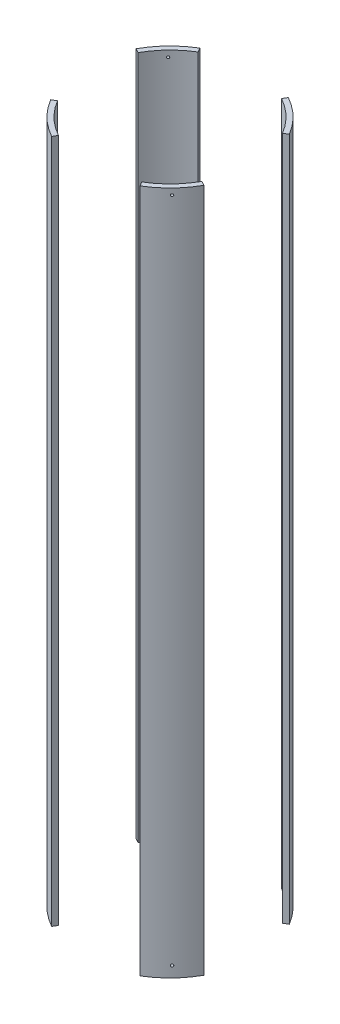
from build123d import *

# Parameters (mm, degrees)
SKETCH2_R               = 88.9
SKETCH2_R_2             = 83.82
BOSS_EXTRUDE1_DEPTH     = 349.510223
CUT_EXTRUDE1_DEPTH      = 372.434807176
CUT_EXTRUDE1_DEPTH_BACK = 372.434807176
SKETCH5_R               = 1.27
BOLT_HOLES_DEPTH        = 399.221412428
BOLT_PATTERN_COUNT      = 4


with BuildPart() as part:
    # Sketch2 → Boss-Extrude1 (new, symmetric)
    with BuildSketch(Plane(origin=(0, 0, 0), x_dir=(1, 0, 0), z_dir=(0, 1, 0))):
        Circle(SKETCH2_R)
        Circle(SKETCH2_R_2, mode=Mode.SUBTRACT)
    extrude(amount=BOSS_EXTRUDE1_DEPTH, both=True)

    # Sketch3 → Cut-Extrude1 (cut, two sides: drawn at the far end of the back side and taken through both)
    with BuildSketch(Plane(origin=(0, 0, 0), x_dir=(1, 0, 0), z_dir=(0, 1, 0)).offset(-CUT_EXTRUDE1_DEPTH_BACK)):
        Polygon((-58.116685864, 96.974944394), (0, 0), (53.900027233, 96.974944394), align=None)
        Polygon((70.991745134, -118.45858783), (0, 0), (-65.840936026, -118.45858783), align=None)
        Polygon((169.661755759, 101.677593364), (0, 0), (169.661755759, -94.300371224), align=None)
        Polygon((-123.741299607, -74.157652604), (0, 0), (-123.741299607, 68.777140945), align=None)
    extrude(amount=CUT_EXTRUDE1_DEPTH + CUT_EXTRUDE1_DEPTH_BACK, mode=Mode.SUBTRACT)


with BuildPart() as cut_extrude1_piece_1:
    # of the separate pieces the step leaves, piece 1, a body of its own (cut_extrude1_pieces)
    add(part.part.solids().sort_by_distance((-45.699187432, -349.510223, -76.254798328))[0])


with BuildPart() as cut_extrude1_piece_2:
    # of the separate pieces the step leaves, piece 2, a body of its own (cut_extrude1_pieces)
    add(part.part.solids().sort_by_distance((45.699187432, -349.510223, 76.254798328))[0])


with BuildPart() as cut_extrude1_piece_3:
    # of the separate pieces the step leaves, piece 3, a body of its own (cut_extrude1_pieces)
    add(part.part.solids().sort_by_distance((76.254798328, -349.510223, -45.699187432))[0])


with BuildPart() as cut_extrude1_piece_4:
    # of the separate pieces the step leaves, piece 4, a body of its own (cut_extrude1_pieces)
    add(part.part.solids().sort_by_distance((-76.254798328, -349.510223, 45.699187432))[0])

    # Sketch5 → Bolt holes (cut, through all)
    with BuildSketch(Plane(origin=(-56.309218645, 0, 58.175814955), x_dir=(-0.7185401515036821, 0, -0.6954854784084752), z_dir=(0.6954854784084752, 0, -0.7185401515036821))):
        with Locations((-0.02278764, 343.160223)):
            Circle(SKETCH5_R)
        with Locations((-0.02278764, -338.397723)):
            Circle(SKETCH5_R)
    bolt_holes = extrude(amount=-BOLT_HOLES_DEPTH, mode=Mode.SUBTRACT)


with BuildPart() as bolt_pattern_tool:
    # Bolt pattern: Bolt holes ×4 about axis
    bolt_pattern_axis = Axis((0, 349.510223, 0), (0, 1, 0))
    for i in range(1, BOLT_PATTERN_COUNT):
        add(bolt_holes.rotate(bolt_pattern_axis, i * 360 / BOLT_PATTERN_COUNT))


with BuildPart() as cut_extrude1_piece_1_1:
    add(cut_extrude1_piece_1.part)

    # Bolt pattern: cut by bolt_pattern_tool
    add(bolt_pattern_tool.part, mode=Mode.SUBTRACT)


with BuildPart() as cut_extrude1_piece_2_1:
    add(cut_extrude1_piece_2.part)

    # Bolt pattern: cut by bolt_pattern_tool
    add(bolt_pattern_tool.part, mode=Mode.SUBTRACT)


with BuildPart() as cut_extrude1_piece_3_1:
    add(cut_extrude1_piece_3.part)

    # Bolt pattern: cut by bolt_pattern_tool
    add(bolt_pattern_tool.part, mode=Mode.SUBTRACT)


solid = Compound([cut_extrude1_piece_4.part, cut_extrude1_piece_1_1.part, cut_extrude1_piece_2_1.part, cut_extrude1_piece_3_1.part])
